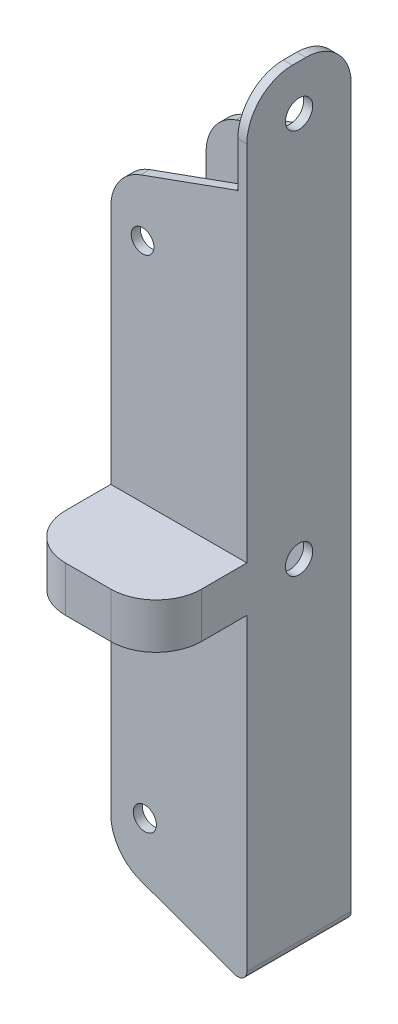
from build123d import *

# Parameters (mm, degrees)
SKETCH1_W           = 30
SKETCH1_H           = 150
BOSS_EXTRUDE2_DEPTH = 23
SKETCH3_W           = 28
SKETCH3_H           = 19
CUT_EXTRUDE1_DEPTH  = 193
SKETCH7_W           = 1.99467658
SKETCH7_H           = 23
BOSS_EXTRUDE4_DEPTH = 20
CUT_EXTRUDE2_DEPTH  = 20
SKETCH9_W           = 30
SKETCH9_H           = 10
BOSS_EXTRUDE5_DEPTH = 20
SKETCH11_R          = 2.5
CUT_EXTRUDE4_DEPTH  = 10
CUT_EXTRUDE5_DEPTH  = 30
FILLET1_R           = 10
SKETCH13_R          = 2.543230184
CUT_EXTRUDE6_DEPTH  = 30
FILLET2_R           = 10
FILLET3_R           = 10
FILLET4_R           = 2


with BuildPart() as part:
    # Sketch1 → Boss-Extrude2 (new body)
    with BuildSketch(Plane.XY):
        with Locations((15, 75)):
            Rectangle(SKETCH1_W, SKETCH1_H)
    extrude(amount=BOSS_EXTRUDE2_DEPTH)

    # Sketch3 → Cut-Extrude1 (cut)
    with BuildSketch(Plane(origin=(0, 150, 0), x_dir=(1, 0, 0), z_dir=(0, 1, 0))):
        with Locations((14, -11.5)):
            Rectangle(SKETCH3_W, SKETCH3_H)
    extrude(amount=-CUT_EXTRUDE1_DEPTH, mode=Mode.SUBTRACT)

    # Sketch7 → Boss-Extrude4 (add)
    with BuildSketch(Plane(origin=(0, 150, 0), x_dir=(1, 0, 0), z_dir=(0, 1, 0))):
        with Locations((29.00266171, -11.5)):
            Rectangle(SKETCH7_W, SKETCH7_H)
    extrude(amount=BOSS_EXTRUDE4_DEPTH)

    # Sketch8 → Cut-Extrude2 (cut)
    with BuildSketch(Plane(origin=(30, 0, 0), x_dir=(0, 0, -1), z_dir=(1, 0, 0))):
        with BuildLine():
            ThreePointArc((-11.5, 78), (-14.5, 75), (-11.5, 72))
            Line((-11.5, 72), (-11.5, 78))
        make_face()
        with BuildLine():
            Line((-11.5, 78), (-11.5, 72))
            ThreePointArc((-11.5, 72), (-9.378679656, 72.878679656), (-8.5, 75))
            ThreePointArc((-8.5, 75), (-9.378679656, 77.121320344), (-11.5, 78))
        make_face()
        with BuildLine():
            ThreePointArc((-13.763816566, 158.031463855), (-11.5, 157), (-9.236183434, 158.031463855))
            Line((-9.236183434, 158.031463855), (-11.5, 160))
            Line((-11.5, 160), (-13.763816566, 158.031463855))
        make_face()
        with BuildLine():
            Line((-11.5, 160), (-9.236183434, 158.031463855))
            ThreePointArc((-9.236183434, 158.031463855), (-8.690066754, 158.94915503), (-8.5, 160))
            ThreePointArc((-8.5, 160), (-8.690066754, 161.05084497), (-9.236183434, 161.968536145))
            Line((-9.236183434, 161.968536145), (-11.5, 160))
        make_face()
        with BuildLine():
            ThreePointArc((-13.763816566, 161.968536145), (-14.5, 160), (-13.763816566, 158.031463855))
            Line((-13.763816566, 158.031463855), (-11.5, 160))
            Line((-11.5, 160), (-13.763816566, 161.968536145))
        make_face()
        with BuildLine():
            Line((-11.5, 160), (-9.236183434, 161.968536145))
            ThreePointArc((-9.236183434, 161.968536145), (-11.5, 163), (-13.763816566, 161.968536145))
            Line((-13.763816566, 161.968536145), (-11.5, 160))
        make_face()
    extrude(amount=-CUT_EXTRUDE2_DEPTH, mode=Mode.SUBTRACT)

    # Sketch9 → Boss-Extrude5 (add)
    with BuildSketch(Plane.XY.offset(23)):
        with Locations((15, 75)):
            Rectangle(SKETCH9_W, SKETCH9_H)
    extrude(amount=BOSS_EXTRUDE5_DEPTH)

    # Sketch11 → Cut-Extrude4 (cut)
    with BuildSketch(Plane.XY.offset(23)):
        with Locations((7.001330855, 130)):
            Circle(SKETCH11_R)
        with Locations((7.5, 20)):
            Circle(SKETCH11_R)
    extrude(amount=-CUT_EXTRUDE4_DEPTH, mode=Mode.SUBTRACT)

    # Sketch12 → Cut-Extrude5 (cut)
    with BuildSketch(Plane.XY.offset(23)):
        Polygon((27.698367508, 150), (0, 150), (0, 140), align=None)
        Polygon((0, 0), (0, 10), (27.698367508, 0), align=None)
    extrude(amount=-CUT_EXTRUDE5_DEPTH, mode=Mode.SUBTRACT)

    # Fillet1
    fillet1_edges = [part.edges().sort_by_distance(p)[0] for p in [
        (0, 140, 1),
        (0, 10, 22),
        (0, 10, 1),
        (0, 140, 22),
    ]]
    fillet(fillet1_edges, radius=FILLET1_R)

    # Sketch13 → Cut-Extrude6 (cut)
    with BuildSketch(Plane.XY.offset(23)):
        with Locations((7.5, 20)):
            Circle(SKETCH13_R)
    extrude(amount=-CUT_EXTRUDE6_DEPTH, mode=Mode.SUBTRACT)

    # Fillet2
    fillet2_edges = [part.edges().sort_by_distance(p)[0] for p in [
        (0, 75, 43),
        (30, 75, 43),
    ]]
    fillet(fillet2_edges, radius=FILLET2_R)

    # Fillet3
    fillet3_edges = [part.edges().sort_by_distance(p)[0] for p in [
        (29.00266171, 170, 23),
        (29.00266171, 170, 0),
    ]]
    fillet(fillet3_edges, radius=FILLET3_R)

    # Fillet4
    fillet4_edges = [part.edges().sort_by_distance(p)[0] for p in [
        (30, 0, 11.5),
    ]]
    fillet(fillet4_edges, radius=FILLET4_R - 0.0001)  # a hair under: the kernel refuses the full size


solid = part.part
